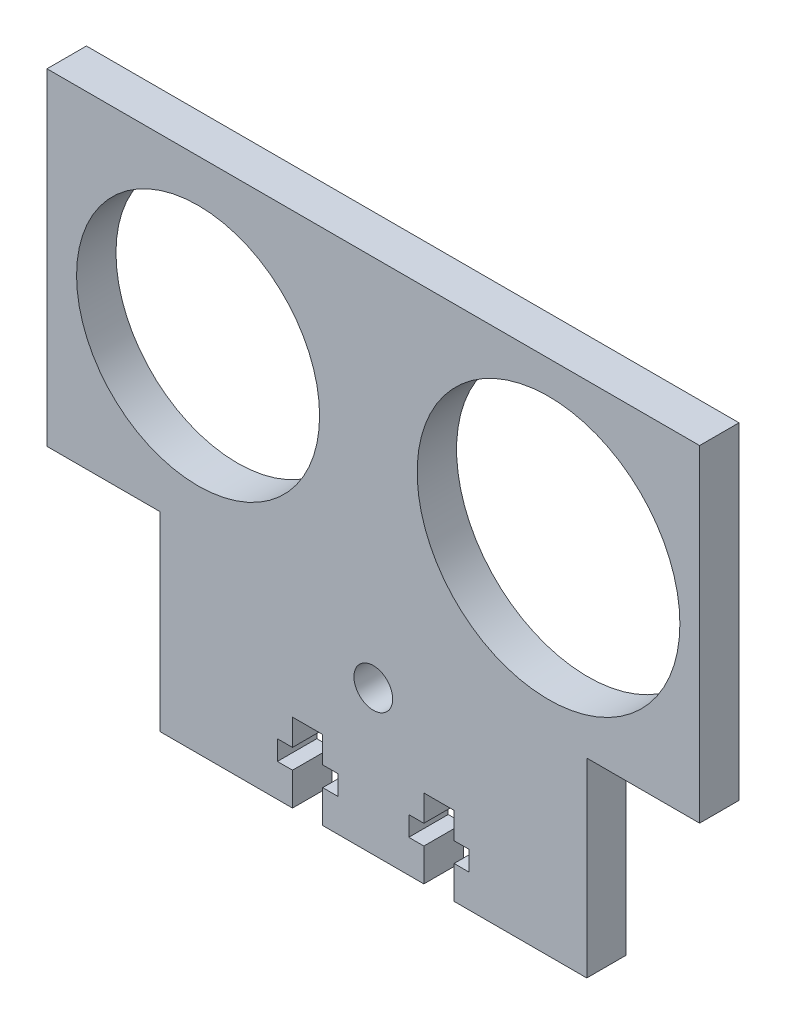
from build123d import *

# Parameters (mm, degrees)
SKETCH1_R           = 2.95
SKETCH1_R_2         = 20
SKETCH1_R_3         = 18.5
BOSS_EXTRUDE1_DEPTH = 6
CUT_EXTRUDE2_DEPTH  = 76.689323992


with BuildPart() as part:
    # Sketch1 → Boss-Extrude1 (new body)
    with BuildSketch(Plane.XY):
        Polygon((-32.5, 7), (-32.5, -22), (32.5, -22), (32.5, 7), (49.675685802, 7), (49.675685802, 56.790844389), (-49.675685802, 56.790844389), (-49.675685802, 7), align=None)
        Circle(SKETCH1_R, mode=Mode.SUBTRACT)
        with Locations((26.675685802, 31.790844389)):
            Circle(SKETCH1_R_2, mode=Mode.SUBTRACT)
        with Locations((-26.675685802, 31.790844389)):
            Circle(SKETCH1_R_3, mode=Mode.SUBTRACT)
    extrude(amount=BOSS_EXTRUDE1_DEPTH)

    # Sketch3 → Cut-Extrude2 (cut, through all)
    with BuildSketch(Plane.XY.offset(6)):
        Polygon((-12.3, -22), (-7.7, -22), (-7.7, -17), (-5.4, -17), (-5.4, -14), (-7.7, -14), (-7.7, -10), (-12.3, -10), (-12.3, -14), (-14.6, -14), (-14.6, -17), (-12.3, -17), align=None)
        Polygon((7.7, -14), (7.7, -10), (12.3, -10), (12.3, -14), (14.6, -14), (14.6, -17), (12.3, -17), (12.3, -22), (7.7, -22), (7.7, -17), (5.4, -17), (5.4, -14), align=None)
    extrude(amount=-CUT_EXTRUDE2_DEPTH, mode=Mode.SUBTRACT)


solid = part.part
